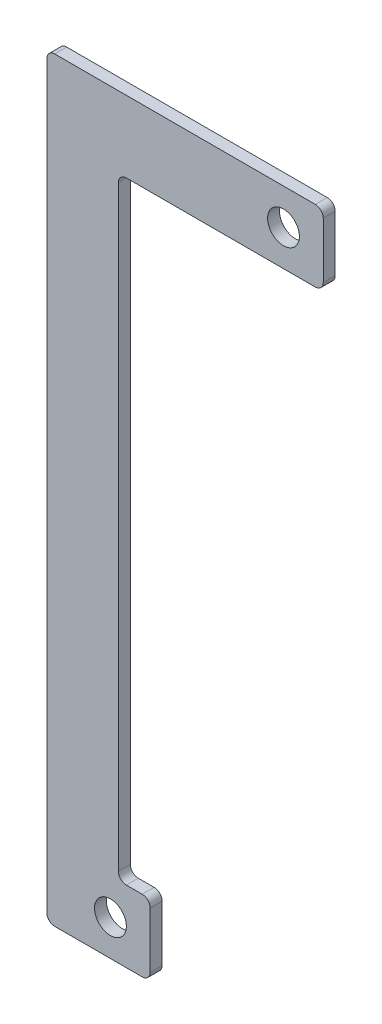
from build123d import *

# Parameters (mm, degrees)
SKETCH1_R           = 2
BOSS_EXTRUDE1_DEPTH = 1.5


with BuildPart() as part:
    # Sketch1 → Boss-Extrude1 (new body)
    with BuildSketch(Plane.XY):
        with BuildLine():
            Line((13, 8), (13, 1))
            ThreePointArc((13, 1), (12.707106781, 0.292893219), (12, 0))
            Line((12, 0), (1, 0))
            ThreePointArc((1, 0), (0.292893219, 0.292893219), (0, 1))
            Line((0, 1), (0, 94.000005673))
            ThreePointArc((0, 94.000005673), (0.292893219, 94.707112454), (1, 95.000005673))
            Line((1, 95.000005673), (33.760008368, 95.000005673))
            ThreePointArc((33.760008368, 95.000005673), (34.467115149, 94.707112454), (34.760008368, 94.000005673))
            Line((34.760008368, 94.000005673), (34.760008368, 87.000005673))
            ThreePointArc((34.760008368, 87.000005673), (34.467115149, 86.292898892), (33.760008368, 86.000005673))
            Line((33.760008368, 86.000005673), (10, 86.000005673))
            ThreePointArc((10, 86.000005673), (9.292893219, 85.707112454), (9, 85.000005673))
            Line((9, 85.000005673), (9, 10))
            ThreePointArc((9, 10), (9.292893219, 9.292893219), (10, 9))
            Line((10, 9), (12, 9))
            ThreePointArc((12, 9), (12.707106781, 8.707106781), (13, 8))
        make_face()
        with Locations((29.760008368, 90.500005673)):
            Circle(SKETCH1_R, mode=Mode.SUBTRACT)
        with Locations((8, 4.5)):
            Circle(SKETCH1_R, mode=Mode.SUBTRACT)
    extrude(amount=BOSS_EXTRUDE1_DEPTH)


solid = part.part
